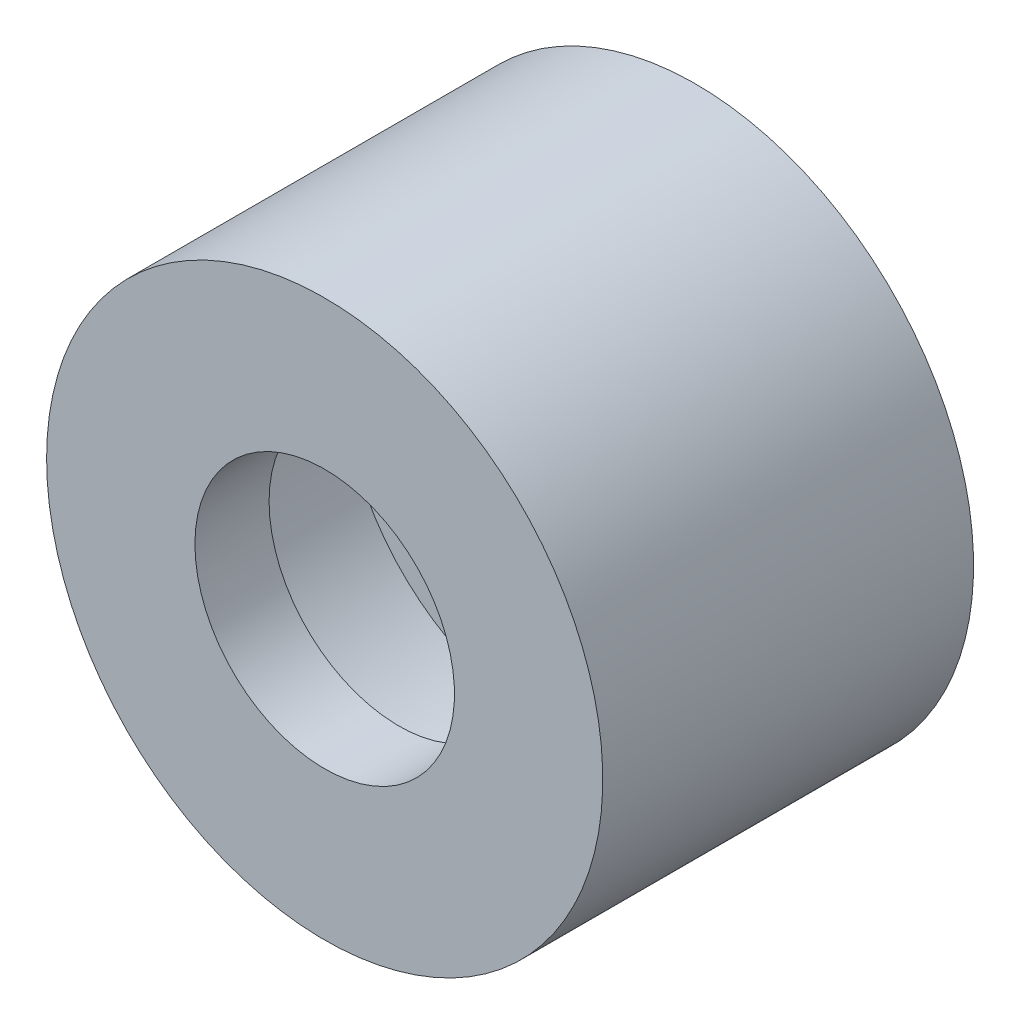
from build123d import *


with BuildPart() as part:
    # Sketch1 → Revolve1 (revolve)
    with BuildSketch(Plane(origin=(0, 0, 0), x_dir=(1, 0, 0), z_dir=(0, 1, 0))):
        Polygon((5.55625, 0), (11.90625, 0), (11.90625, 15.875), (8.73125, 15.875), (8.73125, 12.7), (5.55625, 12.7), (5.55625, 9.525), (8.73125, 9.525), (8.73125, 3.175), (5.55625, 3.175), align=None)
    revolve(axis=Axis((0, 0, -17.186983471), (0, 0, 1)))


solid = part.part
